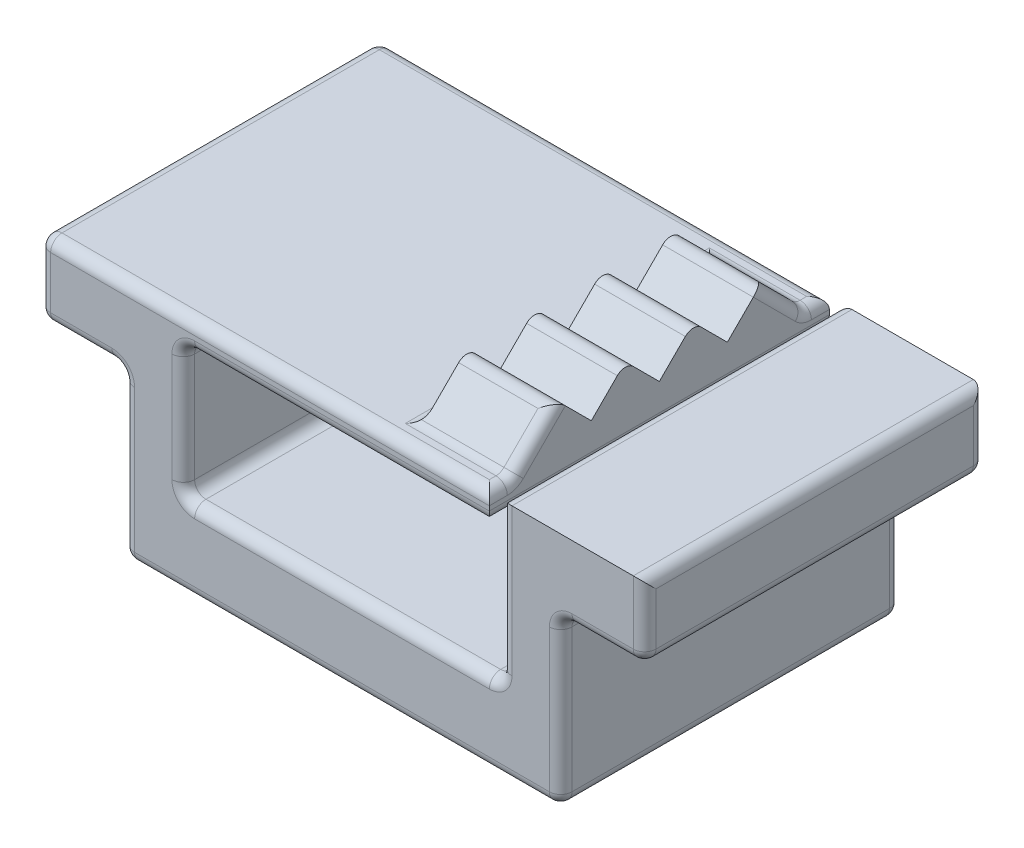
from build123d import *

# Parameters (mm, degrees)
SKETCH2_W           = 9.65
SKETCH2_H           = 3.6
BOSS_EXTRUDE1_DEPTH = 15
SKETCH4_W           = 14
SKETCH4_H           = 7
CUT_EXTRUDE1_DEPTH  = 112.070154559
SKETCH5_W           = 13.5
SKETCH5_H           = 15
BOSS_EXTRUDE2_DEPTH = 1.2
SKETCH6_W           = 3
SKETCH6_H           = 0.5
BOSS_EXTRUDE3_DEPTH = 4
LPATTERN1_COUNT     = 4
LPATTERN1_PITCH     = 3
BOSS_EXTRUDE4_DEPTH = 4
FILLET1_R           = 0.5


with BuildPart() as part:
    # Sketch2 → Boss-Extrude1 (new body)
    with BuildSketch(Plane.XY):
        Polygon((-76.021288744, 76.276019576), (-76.021288744, 79.576019576), (-49.321288744, 79.576019576), (-49.321288744, 76.276019576), (-53.021288744, 76.276019576), (-53.021288744, 72.576019576), (-72.321288744, 72.576019576), (-72.321288744, 76.276019576), align=None)
        with Locations((-57.846288744, 70.776019576)):
            Rectangle(SKETCH2_W, SKETCH2_H)
        with Locations((-67.496288744, 70.776019576)):
            Rectangle(SKETCH2_W, SKETCH2_H)
    extrude(amount=BOSS_EXTRUDE1_DEPTH)

    # Sketch4 → Cut-Extrude1 (cut, through all)
    with BuildSketch(Plane(origin=(0, 0, 0), x_dir=(-1, 0, 0), z_dir=(0, 0, -1))):
        with Locations((62.671288744, 76.076019576)):
            Rectangle(SKETCH4_W, SKETCH4_H)
    extrude(amount=-CUT_EXTRUDE1_DEPTH, mode=Mode.SUBTRACT)

    # Sketch5 → Boss-Extrude2 (add)
    with BuildSketch(Plane(origin=(0, 79.576019576, 0), x_dir=(1, 0, 0), z_dir=(0, 1, 0))):
        with Locations((-62.921288744, -7.5)):
            Rectangle(SKETCH5_W, SKETCH5_H)
    extrude(amount=-BOSS_EXTRUDE2_DEPTH)

    # Sketch6 → Boss-Extrude3 (add)
    with BuildSketch(Plane(origin=(-56.171288744, 0, 0), x_dir=(0, 0, -1), z_dir=(1, 0, 0))):
        with Locations((-12, 79.826019576)):
            Rectangle(SKETCH6_W, SKETCH6_H)
        Polygon((-10.5, 80.076019576), (-13.5, 80.076019576), (-12, 81.576019576), align=None)
    boss_extrude3 = extrude(amount=-BOSS_EXTRUDE3_DEPTH)

    # LPattern1: Boss-Extrude3 ×4
    with Locations(*[(0, 0, -i * LPATTERN1_PITCH) for i in range(1, LPATTERN1_COUNT)]):
        add(boss_extrude3)

    # Sketch7 → Boss-Extrude4 (add)
    with BuildSketch(Plane(origin=(-56.171288744, 0, 0), x_dir=(0, 0, -1), z_dir=(1, 0, 0))):
        Polygon((-13.5, 80.076019576), (-13.5, 79.576019576), (-14, 79.576019576), align=None)
        Polygon((-1.5, 80.076019576), (-1.5, 79.576019576), (-1, 79.576019576), align=None)
    extrude(amount=-BOSS_EXTRUDE4_DEPTH)

    # Fillet1
    fillet1_edges = [part.edges().sort_by_distance(p)[0] for p in [
        (-76.021288744, 76.276019576, 7.5),
        (-76.021288744, 79.576019576, 7.5),
        (-76.021288744, 77.926019576, 0),
        (-76.021288744, 77.926019576, 15),
        (-74.171288744, 76.276019576, 15),
        (-66.096288744, 79.576019576, 15),
        (-62.921288744, 78.376019576, 15),
        (-69.671288744, 75.476019576, 15),
        (-62.671288744, 72.576019576, 15),
        (-55.671288744, 76.076019576, 15),
        (-49.321288744, 77.926019576, 15),
        (-51.171288744, 76.276019576, 15),
        (-53.021288744, 72.626019576, 15),
        (-62.671288744, 68.976019576, 15),
        (-72.321288744, 72.626019576, 15),
        (-72.321288744, 76.276019576, 7.5),
        (-72.321288744, 72.626019576, 0),
        (-72.321288744, 68.976019576, 7.5),
        (-53.021288744, 68.976019576, 7.5),
        (-62.671288744, 68.976019576, 0),
        (-53.021288744, 76.276019576, 7.5),
        (-53.021288744, 72.626019576, 0),
        (-49.321288744, 76.276019576, 7.5),
        (-51.171288744, 76.276019576, 0),
        (-49.321288744, 79.576019576, 7.5),
        (-49.321288744, 77.926019576, 0),
        (-55.671288744, 79.576019576, 7.5),
        (-55.671288744, 76.076019576, 0),
        (-55.671288744, 72.576019576, 7.5),
        (-62.671288744, 72.576019576, 0),
        (-69.671288744, 72.576019576, 7.5),
        (-69.671288744, 75.476019576, 0),
        (-69.671288744, 78.376019576, 7.5),
        (-62.921288744, 78.376019576, 0),
        (-56.171288744, 78.376019576, 7.5),
        (-56.171288744, 79.576019576, 14.5),
        (-56.171288744, 80.576019576, 13),
        (-56.171288744, 80.576019576, 2),
        (-56.171288744, 79.576019576, 0.5),
        (-58.171288744, 79.576019576, 1),
        (-58.171288744, 81.576019576, 3),
        (-60.171288744, 79.576019576, 7.5),
        (-58.171288744, 81.576019576, 6),
        (-58.171288744, 81.576019576, 9),
        (-58.171288744, 81.576019576, 12),
        (-58.171288744, 79.576019576, 14),
        (-74.171288744, 76.276019576, 0),
        (-66.096288744, 79.576019576, 0),
    ]]
    fillet(fillet1_edges, radius=FILLET1_R - 0.0001)  # a hair under: the kernel refuses the full size


solid = part.part
